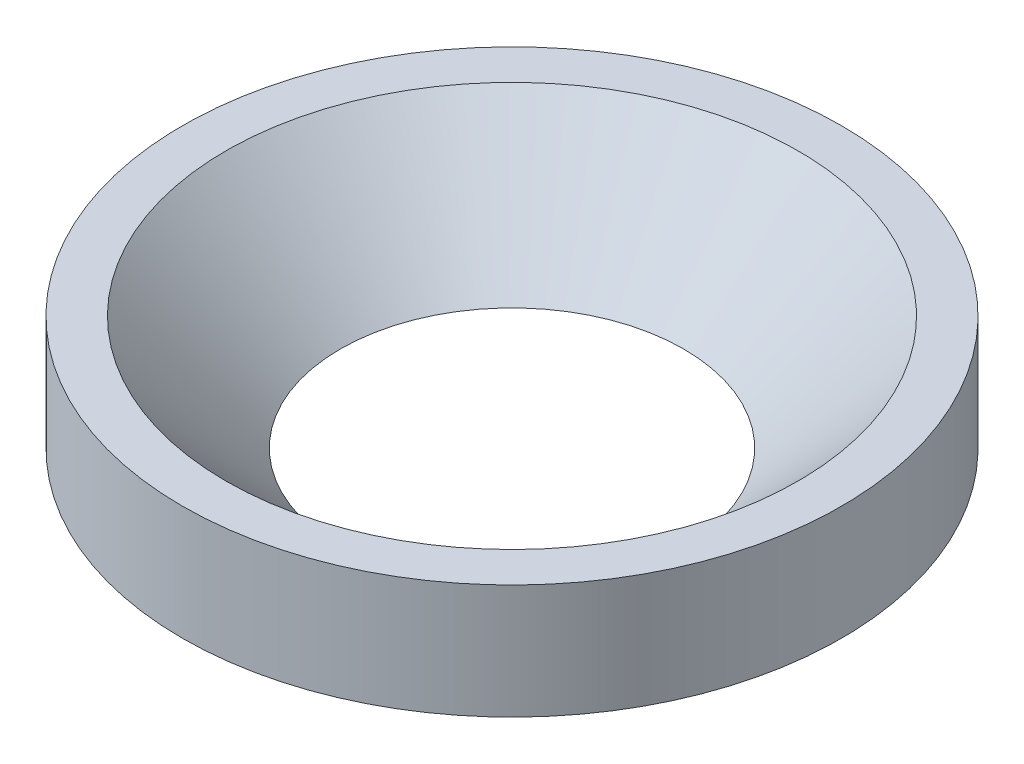
from build123d import *

# Parameters (mm, degrees)
SKETCH1_R           = 5.76
SKETCH1_R_2         = 3
BOSS_EXTRUDE1_DEPTH = 2
CHAMFER1_SIZE       = 2


with BuildPart() as part:
    # Sketch1 → Boss-Extrude1 (new body)
    with BuildSketch(Plane(origin=(0, 0, 0), x_dir=(1, 0, 0), z_dir=(0, 1, 0))):
        with Locations(Location((0, 0, 0), (0, 0, 270))):
            Circle(SKETCH1_R)
        with Locations(Location((0, 0, 0), (0, 0, 270))):
            Circle(SKETCH1_R_2, mode=Mode.SUBTRACT)
    extrude(amount=BOSS_EXTRUDE1_DEPTH)

    # Chamfer1
    chamfer1_edges = [part.edges().sort_by_distance(p)[0] for p in [
        (0, 2, -3),
    ]]
    chamfer(chamfer1_edges, length=CHAMFER1_SIZE - 0.0001)  # a hair under: the kernel refuses the full size


solid = part.part
